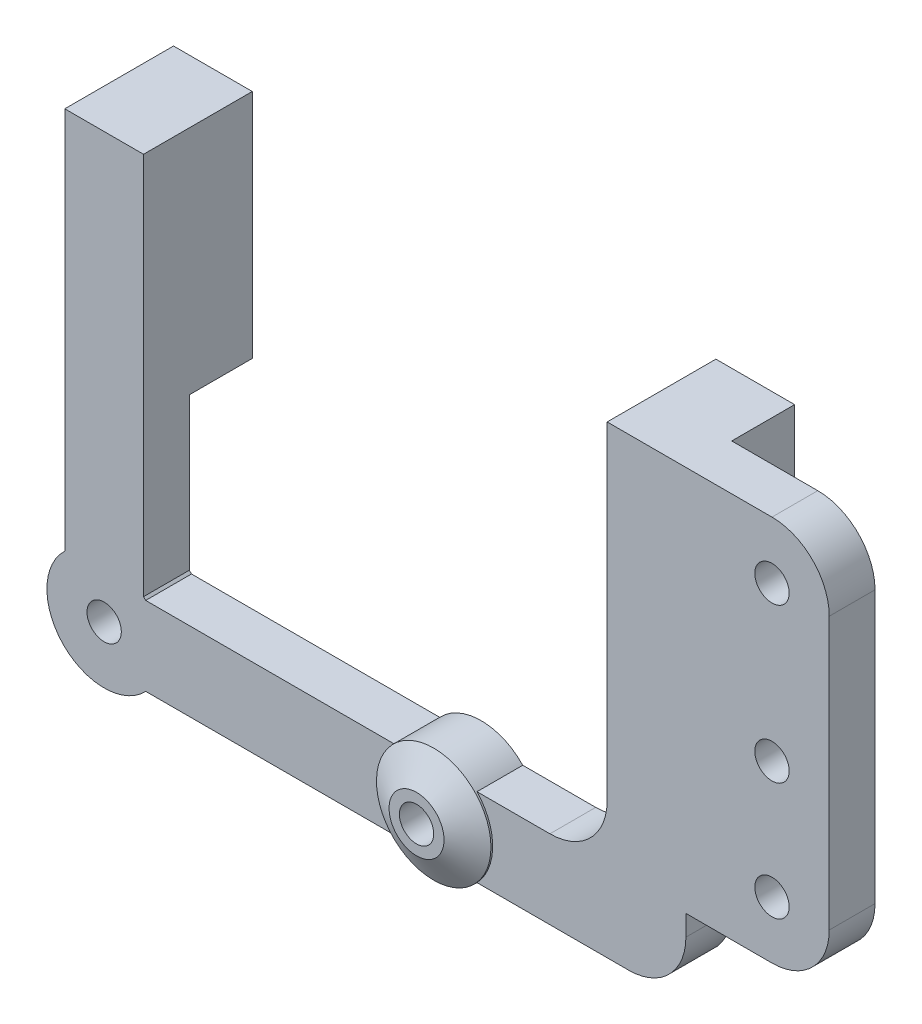
from build123d import *

# Parameters (mm, degrees)
CROQUIS1_R              = 1.5
SALIENTE_EXTRUIR1_DEPTH = 4
CROQUIS2_W              = 6.88
CROQUIS2_H              = 20.2
SALIENTE_EXTRUIR2_DEPTH = 5.5
CROQUIS3_R              = 5
CROQUIS3_R_2            = 1.5
SALIENTE_EXTRUIR3_DEPTH = 1.65
CROQUIS4_R              = 1.5
SALIENTE_EXTRUIR4_DEPTH = 1
CROQUIS5_R              = 1.25
CORTAR_EXTRUIR1_DEPTH   = 8


with BuildPart() as part:
    # Croquis1 → Saliente-Extruir1 (new body)
    with BuildSketch(Plane.XY):
        with BuildLine():
            Line((59.9, -8.54), (59.9, 15.2))
            ThreePointArc((59.9, 15.2), (58.435533906, 18.735533906), (54.9, 20.2))
            Line((54.9, 20.2), (40.5, 20.2))
            Line((40.5, 20.2), (40.5, -8.46))
            ThreePointArc((40.5, -8.46), (39.035533906, -11.995533906), (35.5, -13.46))
            Line((35.5, -13.46), (29.128553431, -13.46))
            ThreePointArc((29.128553431, -13.46), (25.5, -11.9), (21.871446569, -13.46))
            Line((21.871446569, -13.46), (0.188553431, -13.46))
            ThreePointArc((0.188553431, -13.46), (0.095533906, -13.364466094), (0, -13.271446569))
            Line((0, -13.271446569), (0, 20.2))
            Line((0, 20.2), (-6.88, 20.2))
            Line((-6.88, 20.2), (-6.88, -13.271446569))
            ThreePointArc((-6.88, -13.271446569), (-6.975533906, -20.435533906), (0.188553431, -20.34))
            Line((0.188553431, -20.34), (21.871446569, -20.34))
            ThreePointArc((21.871446569, -20.34), (25.5, -21.9), (29.128553431, -20.34))
            Line((29.128553431, -20.34), (42.38, -20.34))
            ThreePointArc((42.38, -20.34), (45.915533906, -18.875533906), (47.38, -15.34))
            Line((47.38, -15.34), (47.38, -13.54))
            Line((47.38, -13.54), (54.9, -13.54))
            ThreePointArc((54.9, -13.54), (58.435533906, -12.075533906), (59.9, -8.54))
        make_face()
        with Locations((54.9, 1.74)):
            Circle(CROQUIS1_R, mode=Mode.SUBTRACT)
        with Locations((54.9, -8.54)):
            Circle(CROQUIS1_R, mode=Mode.SUBTRACT)
        with Locations((25.5, -16.9)):
            Circle(CROQUIS1_R, mode=Mode.SUBTRACT)
        with Locations((-3.44, -16.9)):
            Circle(CROQUIS1_R, mode=Mode.SUBTRACT)
        with Locations((54.9, 15.2)):
            Circle(CROQUIS1_R, mode=Mode.SUBTRACT)
    extrude(amount=SALIENTE_EXTRUIR1_DEPTH)

    # Croquis2 → Saliente-Extruir2 (add)
    with BuildSketch(Plane(origin=(0, 0, 0), x_dir=(-1, 0, 0), z_dir=(0, 0, -1))):
        with Locations((-43.94, 10.1)):
            Rectangle(CROQUIS2_W, CROQUIS2_H)
        with Locations((3.44, 10.1)):
            Rectangle(CROQUIS2_W, CROQUIS2_H)
    extrude(amount=SALIENTE_EXTRUIR2_DEPTH)

    # Croquis3 → Saliente-Extruir3 (add)
    with BuildSketch(Plane.XY.offset(4)):
        with Locations(Location((25.5, -16.9, 0), (0, 0, 136.528000689))):
            Circle(CROQUIS3_R)
        with Locations(Location((25.5, -16.9, 0), (0, 0, 249.548360479))):
            Circle(CROQUIS3_R_2, mode=Mode.SUBTRACT)
    extrude(amount=SALIENTE_EXTRUIR3_DEPTH)

    # Croquis4 → Saliente-Extruir4 (add)
    with BuildSketch(Plane(origin=(0, 0, 0), x_dir=(-1, 0, 0), z_dir=(0, 0, -1))):
        with Locations((-25.5, -16.9)):
            Circle(CROQUIS4_R)
        with Locations((-54.9, 1.74)):
            Circle(CROQUIS4_R)
        with Locations((-54.9, -8.54)):
            Circle(CROQUIS4_R)
    extrude(amount=-SALIENTE_EXTRUIR4_DEPTH)

    # Croquis5 → Cortar-Extruir1 (cut)
    with BuildSketch(Plane(origin=(0, 0, -5.5), x_dir=(-1, 0, 0), z_dir=(0, 0, -1))):
        with Locations((-45.5, 5.4)):
            Circle(CROQUIS5_R)
        with Locations((-45.5, 14.8)):
            Circle(CROQUIS5_R)
        with Locations((5, 14.8)):
            Circle(CROQUIS5_R)
        with Locations((5, 5.4)):
            Circle(CROQUIS5_R)
    extrude(amount=-CORTAR_EXTRUIR1_DEPTH, mode=Mode.SUBTRACT)

    # Chaflán1: read off the stored shape, not the designer's step
    # Chaflán1 outline → Chaflán1 (revolve, cut)
    with BuildSketch(Plane(origin=(25.5, -16.9, 0), x_dir=(1, 0, 0), z_dir=(0, -1, 0))):
        Polygon((5, 5.65), (2.401923789, 5.65), (5, 4.15), align=None)
    revolve(axis=Axis((25.5, -16.9, 0), (0, 0, 1)), mode=Mode.SUBTRACT)


solid = part.part
